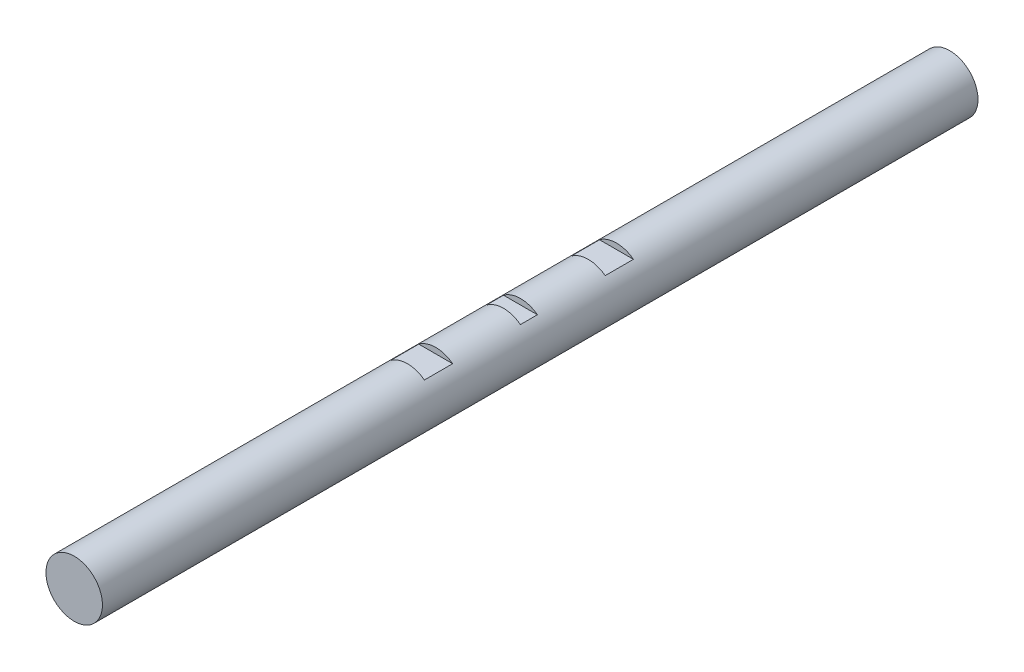
from build123d import *

# Parameters (mm, degrees)
BOSS_EXTRUDE1_DEPTH      = 77.5
BOSS_EXTRUDE1_DEPTH_BACK = 77.5
SKETCH1_R                = 5
CUT_EXTRUDE1_DEPTH       = 78.821912081
CUT_EXTRUDE1_DEPTH_BACK  = 78.821912081
SKETCH3_W                = 5
SKETCH3_H                = 1
SKETCH3_W_2              = 3


with BuildPart() as part:
    # Sketch1 → Boss-Extrude1 (new, two sides: drawn at the far end of the back side and taken through both)
    with BuildSketch(Plane.XY.offset(-BOSS_EXTRUDE1_DEPTH_BACK)):
        Circle(SKETCH1_R)
    extrude(amount=BOSS_EXTRUDE1_DEPTH + BOSS_EXTRUDE1_DEPTH_BACK)

    # Sketch3 → Cut-Extrude1 (cut, two sides: drawn at the far end of the back side and taken through both)
    with BuildSketch(Plane(origin=(0, 0, 0), x_dir=(0, 0, -1), z_dir=(1, 0, 0)).offset(-CUT_EXTRUDE1_DEPTH_BACK)):
        with Locations((16, 4.5)):
            Rectangle(SKETCH3_W, SKETCH3_H)
        with Locations((-16, 4.5)):
            Rectangle(SKETCH3_W, SKETCH3_H)
        with Locations((0, 4.5)):
            Rectangle(SKETCH3_W_2, SKETCH3_H)
    extrude(amount=CUT_EXTRUDE1_DEPTH + CUT_EXTRUDE1_DEPTH_BACK, mode=Mode.SUBTRACT)


solid = part.part
